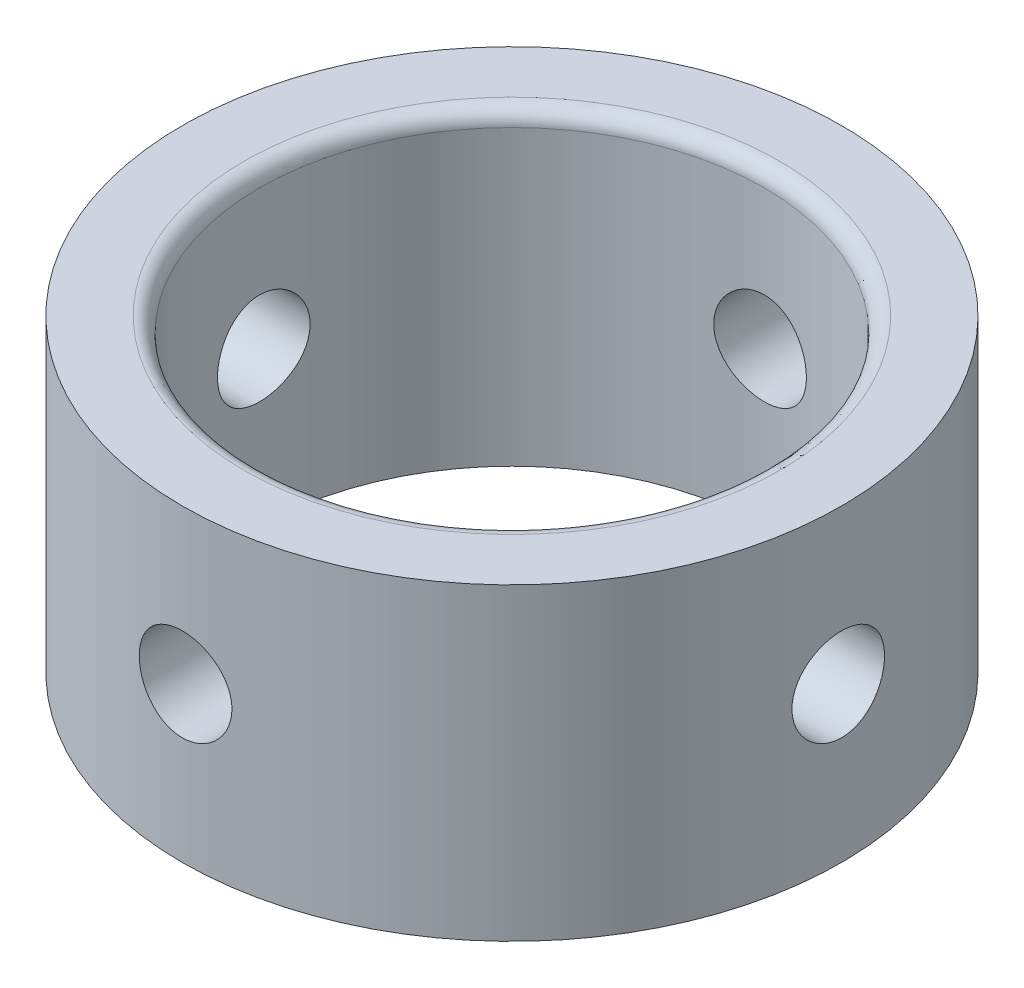
from build123d import *

# Parameters (mm, degrees)
SKETCH1_R           = 21.35
SKETCH1_R_2         = 16.35
BOSS_EXTRUDE1_DEPTH = 20
FILLET1_R           = 1
SKETCH2_R           = 3
CUT_EXTRUDE1_DEPTH  = 10
CIRPATTERN1_COUNT   = 4


with BuildPart() as part:
    # Sketch1 → Boss-Extrude1 (new body)
    with BuildSketch(Plane(origin=(0, 0, 0), x_dir=(1, 0, 0), z_dir=(0, 1, 0))):
        Circle(SKETCH1_R)
        Circle(SKETCH1_R_2, mode=Mode.SUBTRACT)
    extrude(amount=BOSS_EXTRUDE1_DEPTH)

    # Fillet1
    fillet1_edges = [part.edges().sort_by_distance(p)[0] for p in [
        (-16.35, 20, 0),
    ]]
    fillet(fillet1_edges, radius=FILLET1_R)

    # Sketch2 → Cut-Extrude1 (cut)
    with BuildSketch(Plane(origin=(21.35, 0, 0), x_dir=(0, 0, -1), z_dir=(1, 0, 0))):
        with Locations((0, 10)):
            Circle(SKETCH2_R)
    cut_extrude1 = extrude(amount=-CUT_EXTRUDE1_DEPTH, mode=Mode.SUBTRACT)

    # CirPattern1: Cut-Extrude1 ×4 about axis
    cirpattern1_axis = Axis((0, 19, 0), (0, -1, 0))
    for i in range(1, CIRPATTERN1_COUNT):
        add(cut_extrude1.rotate(cirpattern1_axis, i * 360 / CIRPATTERN1_COUNT), mode=Mode.SUBTRACT)


solid = part.part
